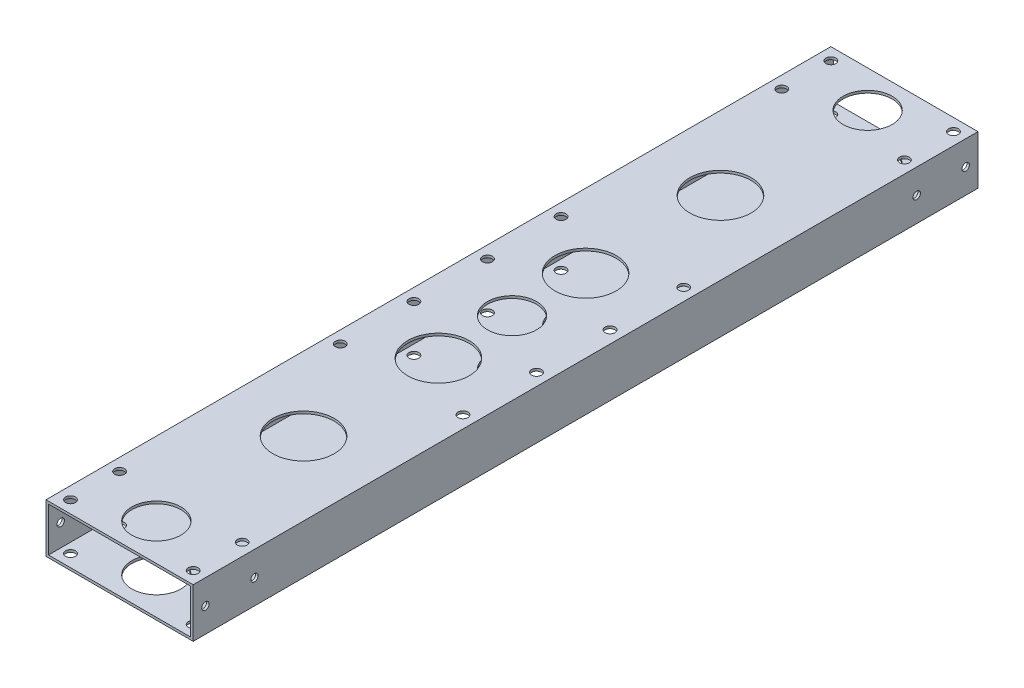
from build123d import *

# Parameters (mm, degrees)
SKETCH_1_W          = 60
SKETCH_1_H          = 20
SKETCH_1_W_2        = 58
SKETCH_1_H_2        = 18
EXTRUDE_1_DEPTH     = 320
SKETCH_2_R          = 2
CUT_EXTRUDE_1_DEPTH = 327.190128606
SKETCH_4_R          = 1.5
CUT_EXTRUDE_2_DEPTH = 327.190128606
SKETCH_5_R          = 10
SKETCH_5_R_2        = 12.5
CUT_EXTRUDE_3_DEPTH = 327.190128606


with BuildPart() as part:
    # 草图1 → 拉伸-薄壁1 (new body)
    with BuildSketch(Plane.XY):
        with Locations((30, 10)):
            Rectangle(SKETCH_1_W, SKETCH_1_H)
        with Locations((30, 10)):
            Rectangle(SKETCH_1_W_2, SKETCH_1_H_2, mode=Mode.SUBTRACT)
    extrude(amount=EXTRUDE_1_DEPTH)

    # 草图2 → 切除-拉伸1 (cut, through all)
    with BuildSketch(Plane(origin=(0, 20, 0), x_dir=(1, 0, 0), z_dir=(0, 1, 0))):
        with Locations((5, -145)):
            Circle(SKETCH_2_R)
        with Locations((5, -175)):
            Circle(SKETCH_2_R)
        with Locations((55, -175)):
            Circle(SKETCH_2_R)
        with Locations((55, -145)):
            Circle(SKETCH_2_R)
        with Locations((5, -115)):
            Circle(SKETCH_2_R)
        with Locations((5, -205)):
            Circle(SKETCH_2_R)
        with Locations((55, -205)):
            Circle(SKETCH_2_R)
        with Locations((55, -115)):
            Circle(SKETCH_2_R)
        with Locations((5, -5)):
            Circle(SKETCH_2_R)
        with Locations((55, -5)):
            Circle(SKETCH_2_R)
        with Locations((55, -25)):
            Circle(SKETCH_2_R)
        with Locations((5, -25)):
            Circle(SKETCH_2_R)
        with Locations((5, -295)):
            Circle(SKETCH_2_R)
        with Locations((55, -295)):
            Circle(SKETCH_2_R)
        with Locations((55, -315)):
            Circle(SKETCH_2_R)
        with Locations((5, -315)):
            Circle(SKETCH_2_R)
    extrude(amount=-CUT_EXTRUDE_1_DEPTH, mode=Mode.SUBTRACT)

    # 草图4 → 切除-拉伸2 (cut, through all)
    with BuildSketch(Plane(origin=(60, 0, 0), x_dir=(0, 0, -1), z_dir=(1, 0, 0))):
        with Locations((-315, 10)):
            Circle(SKETCH_4_R)
        with Locations((-295, 10)):
            Circle(SKETCH_4_R)
        with Locations((-25, 10)):
            Circle(SKETCH_4_R)
        with Locations((-5, 10)):
            Circle(SKETCH_4_R)
    extrude(amount=-CUT_EXTRUDE_2_DEPTH, mode=Mode.SUBTRACT)

    # 草图5 → 切除-拉伸3 (cut, through all)
    with BuildSketch(Plane(origin=(0, 20, 0), x_dir=(1, 0, 0), z_dir=(0, 1, 0))):
        with Locations((30, -160)):
            Circle(SKETCH_5_R)
        with Locations((30, -130)):
            Circle(SKETCH_5_R_2)
        with Locations((30, -190)):
            Circle(SKETCH_5_R_2)
        with Locations((30, -75)):
            Circle(SKETCH_5_R_2)
        with Locations((30, -15)):
            Circle(SKETCH_5_R)
        with Locations((30, -305)):
            Circle(SKETCH_5_R)
        with Locations((30, -245)):
            Circle(SKETCH_5_R_2)
    extrude(amount=-CUT_EXTRUDE_3_DEPTH, mode=Mode.SUBTRACT)


solid = part.part
